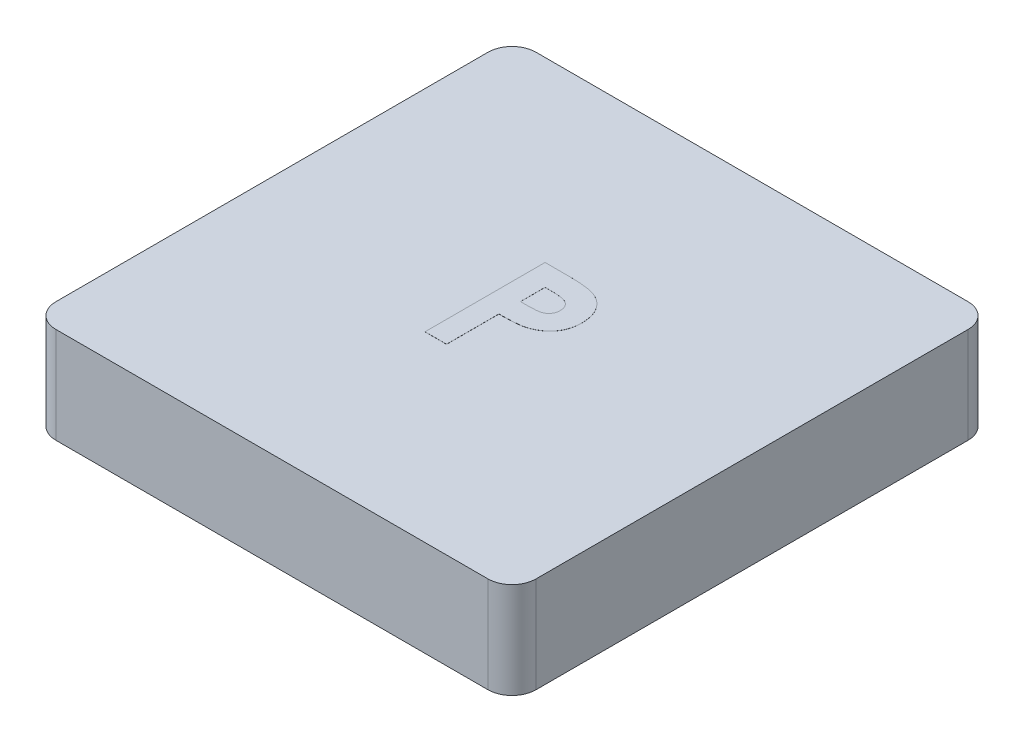
from build123d import *

# Parameters (mm, degrees)
SKETCH1_W           = 12.7
SKETCH1_H           = 12.7
BOSS_EXTRUDE1_DEPTH = 2.54
FILLET1_R           = 0.635
SHELL1_START        = 0.635
SHELL1_OUTLINE_W    = 1.905
SHELL1_OUTLINE_H    = 11.43
SHELL1_DEPTH        = 11.43
SKETCH2_R           = 2.54
BOSS_EXTRUDE2_DEPTH = 1.905
BOSS_EXTRUDE3_DEPTH = 0.00254


# Read off the part's stored shape, not the designer's step: Shell1
with BuildPart() as part:
    # Sketch1 → Boss-Extrude1 (new body)
    with BuildSketch(Plane(origin=(0, 0, 0), x_dir=(1, 0, 0), z_dir=(0, 1, 0))):
        with Locations((6.35, 6.35)):
            Rectangle(SKETCH1_W, SKETCH1_H)
    extrude(amount=BOSS_EXTRUDE1_DEPTH)

    # Fillet1
    fillet1_edges = [part.edges().sort_by_distance(p)[0] for p in [
        (0, 1.27, -12.7),
        (12.7, 1.27, -12.7),
        (12.7, 1.27, 0),
        (0, 1.27, 0),
    ]]
    fillet(fillet1_edges, radius=FILLET1_R)

    # Shell1 outline → Shell1 (cut)
    with BuildSketch(Plane.YZ.offset(SHELL1_START)):
        with Locations((0.9525, -6.35)):
            Rectangle(SHELL1_OUTLINE_W, SHELL1_OUTLINE_H)
    extrude(amount=SHELL1_DEPTH, mode=Mode.SUBTRACT)

    # Sketch2 → Boss-Extrude2 (add)
    with BuildSketch(Plane(origin=(0, 1.905, 0), x_dir=(-1, 0, 0), z_dir=(0, -1, 0))):
        with Locations(Location((-6.35, 6.35, 0), (0, 0, 270))):
            Circle(SKETCH2_R)
    extrude(amount=BOSS_EXTRUDE2_DEPTH)

    # Sketch3 → Boss-Extrude3 (add)
    with BuildSketch(Plane(origin=(0, 2.54, 0), x_dir=(1, 0, 0), z_dir=(0, 1, 0))):
        with BuildLine():
            Line((5.573346154, 8.001), (6.209363782, 8.001))
            add(Edge.make_bspline(
                [(6.209363782, 8.001), (6.250920349, 8.000813984), (6.331091677, 8.00045512), (6.446705328, 7.996103418), (6.553364582, 7.988304902), (6.651044933, 7.978667169), (6.739706219, 7.965155443), (6.81945947, 7.949665308), (6.890321237, 7.930793814), (6.95309059, 7.908393613), (7.009424058, 7.88198465), (7.062733687, 7.85385722), (7.111814675, 7.820288125), (7.159144287, 7.784895298), (7.202016608, 7.744297677), (7.243106269, 7.701197093), (7.280673012, 7.653884211), (7.314890906, 7.602931741), (7.345931809, 7.549281068), (7.373051219, 7.492836279), (7.395048965, 7.433508057), (7.413502339, 7.371680187), (7.428324268, 7.307355365), (7.438190216, 7.240137987), (7.444891665, 7.17049739), (7.445482975, 7.123099955), (7.445782051, 7.099127003)],
                knots=[0, 0, 0, 0, 1.698747864, 3.27724071, 4.728299578, 6.070144658, 7.288476769, 8.393259625, 9.389771311, 10.283485332, 11.113357557, 11.931608583, 12.74405601, 13.541433047, 14.344816069, 15.154114104, 15.974336324, 16.810834471, 17.661136416, 18.50621059, 19.367396281, 20.244825668, 21.142564693, 22.063065223, 23.020325768, 24, 24, 24, 24], degree=3))
            add(Edge.make_bspline(
                [(7.445782051, 7.099127003), (7.445349325, 7.072606297), (7.444498965, 7.02048985), (7.436162698, 6.944093533), (7.421921719, 6.871256561), (7.403309504, 6.801364688), (7.377356095, 6.735567789), (7.347705543, 6.672295931), (7.31122596, 6.613323062), (7.269542204, 6.557911502), (7.224018788, 6.50561073), (7.173574986, 6.457930831), (7.11917228, 6.414546773), (7.061125587, 6.375003888), (6.999216983, 6.339381942), (6.933491138, 6.307347374), (6.863499238, 6.279924749), (6.814758985, 6.265582938), (6.790047877, 6.258311699)],
                knots=[0, 0, 0, 0, 1.102006807, 2.165578795, 3.188629044, 4.184801286, 5.166646146, 6.124351954, 7.085497154, 8.042432466, 9.003981491, 9.963833307, 10.922997304, 11.89326795, 12.880200226, 13.889073926, 14.929769137, 16, 16, 16, 16], degree=3))
            add(Edge.make_bspline(
                [(6.790047877, 6.258311699), (6.773771719, 6.254262164), (6.738512321, 6.245489569), (6.680167701, 6.236583183), (6.612931652, 6.228394308), (6.536586757, 6.221356962), (6.451089, 6.216573206), (6.356521166, 6.212837306), (6.252840398, 6.210120921), (6.180744892, 6.210024531), (6.143217949, 6.209974359)],
                knots=[0, 0, 0, 0, 0.618981996, 1.340914327, 2.176866532, 3.120127938, 4.170906482, 5.338178032, 6.614476169, 8, 8, 8, 8], degree=3))
            Line((6.143217949, 6.209974359), (6.143217949, 4.826))
            Line((6.143217949, 4.826), (5.573346154, 4.826))
            Line((5.573346154, 4.826), (5.573346154, 8.001))
        make_face()
        with BuildLine():
            Line((6.143217949, 6.779846154), (6.344835537, 6.779846154))
            add(Edge.make_bspline(
                [(6.344835537, 6.779846154), (6.38152304, 6.780078781), (6.449028591, 6.780506819), (6.541217335, 6.786696491), (6.615301984, 6.796149371), (6.673830231, 6.809706987), (6.720043827, 6.830282464), (6.759900159, 6.854084417), (6.794085953, 6.884181333), (6.823685819, 6.918572209), (6.84735002, 6.958089049), (6.863759911, 7.002088399), (6.874419453, 7.049645784), (6.875403961, 7.082742577), (6.875910256, 7.099763021)],
                knots=[0, 0, 0, 0, 1.8619151, 3.425951444, 4.686033666, 5.651700536, 6.461346321, 7.243864085, 7.999046032, 8.762387399, 9.539336099, 10.322741239, 11.137448474, 12, 12, 12, 12], degree=3))
            add(Edge.make_bspline(
                [(6.875910256, 7.099763021), (6.875409169, 7.114633561), (6.874436938, 7.143485985), (6.867294669, 7.185127188), (6.855911946, 7.22394538), (6.839418817, 7.259535156), (6.818097108, 7.291836043), (6.792101629, 7.320835316), (6.761765954, 7.34715402), (6.73834504, 7.361084912), (6.726446114, 7.36816246)],
                knots=[0, 0, 0, 0, 1.102301479, 2.1387299, 3.123554645, 4.094223062, 5.036071848, 5.982632524, 6.975082478, 8, 8, 8, 8], degree=3))
            add(Edge.make_bspline(
                [(6.726446114, 7.36816246), (6.716367037, 7.373259738), (6.695027566, 7.384051721), (6.658684377, 7.39659819), (6.616744892, 7.407182518), (6.568925973, 7.415967409), (6.515418382, 7.422785396), (6.456231666, 7.427999451), (6.391278727, 7.430096225), (6.346107844, 7.430774724), (6.32257492, 7.431128205)],
                knots=[0, 0, 0, 0, 0.656809284, 1.390599849, 2.23162475, 3.173112763, 4.218524733, 5.370385145, 6.63003504, 8, 8, 8, 8], degree=3))
            Line((6.32257492, 7.431128205), (6.143217949, 7.431128205))
            Line((6.143217949, 7.431128205), (6.143217949, 6.779846154))
        make_face(mode=Mode.SUBTRACT)
    extrude(amount=BOSS_EXTRUDE3_DEPTH)


solid = part.part
